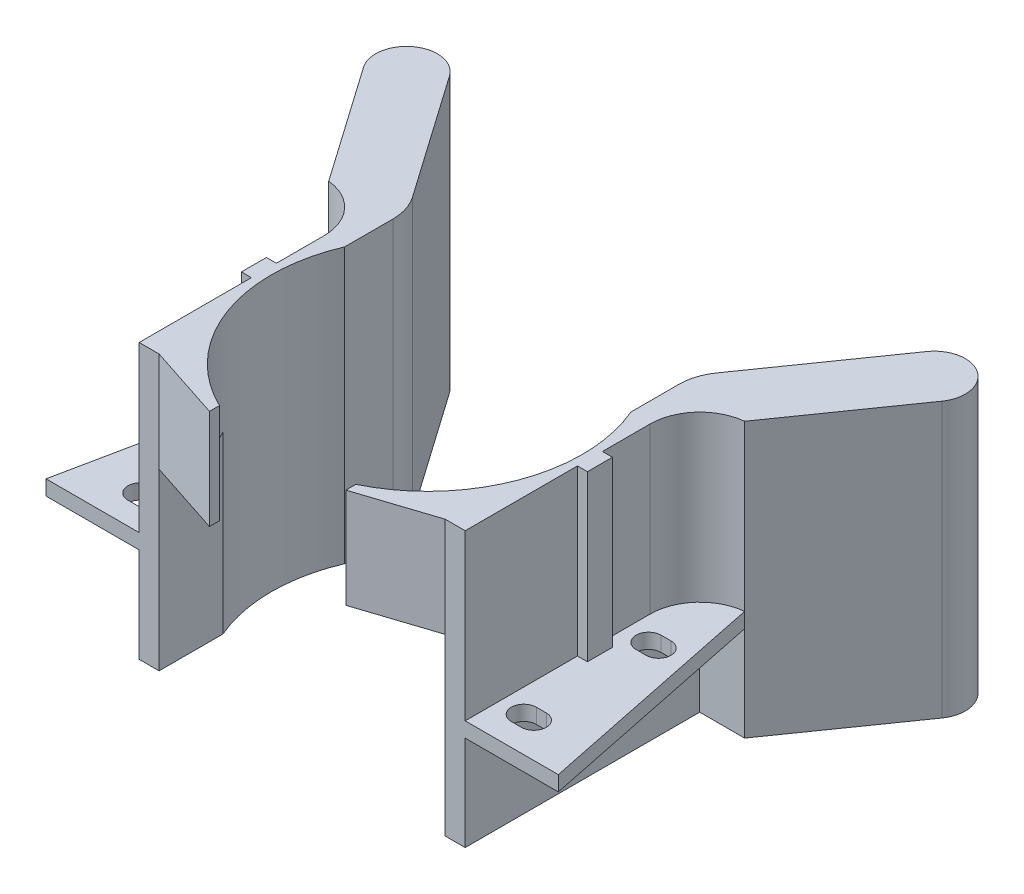
from build123d import *

# Parameters (mm, degrees)
BOSS_EXTRU_1_DEPTH      = 55
CONG_1_R                = 10
ESQUISSE2_R             = 31
ENL_V_MAT_EXTRU_1_DEPTH = 108.780485936
BOSS_EXTRU_2_DEPTH      = 3
ESQUISSE4_W             = 2
ESQUISSE4_H             = 33
BOSS_EXTRU_3_DEPTH      = 2.5
CONG_2_R                = 10
BOSS_EXTRU_4_DEPTH      = 20


with BuildPart() as part:
    # Esquisse1 → Boss.-Extru.1 (new body)
    with BuildSketch(Plane(origin=(0, 20, 0), x_dir=(1, 0, 0), z_dir=(0, 1, 0))):
        with BuildLine():
            Line((32.673562069, -8.580941108), (32.673562069, 38.419058892))
            Line((32.673562069, 38.419058892), (41.673562069, 38.419058892))
            Line((41.673562069, 38.419058892), (57.965753801, 61.686720039))
            ThreePointArc((57.965753801, 61.686720039), (56.44690478, 70.300540881), (47.833083938, 68.781691859))
            Line((47.833083938, 68.781691859), (28.673562069, 41.419058892))
            Line((28.673562069, 41.419058892), (28.673562069, -8.580941108))
            Line((28.673562069, -8.580941108), (32.673562069, -8.580941108))
        make_face()
    extrude(amount=BOSS_EXTRU_1_DEPTH)

    # Congé1
    cong_1_edges = [part.edges().sort_by_distance(p)[0] for p in [
        (28.673562069, 47.5, -41.419058892),
    ]]
    fillet(cong_1_edges, radius=CONG_1_R)

    # Esquisse2 → Enlèv. mat.-Extru.1 (cut, through all)
    with BuildSketch(Plane(origin=(0, 75, 0), x_dir=(1, 0, 0), z_dir=(0, 1, 0))):
        with Locations((0.173562069, 16.419058892)):
            Circle(ESQUISSE2_R)
    extrude(amount=-ENL_V_MAT_EXTRU_1_DEPTH, mode=Mode.SUBTRACT)

    # Esquisse3 → Boss.-Extru.2 (add)
    with BuildSketch(Plane(origin=(0, 39, 0), x_dir=(1, 0, 0), z_dir=(0, 1, 0))):
        Polygon((32.673562069, -8.580941108), (32.673562069, 38.419058892), (41.673562069, 38.419058892), (51.341622453, -8.580941108), align=None)
        with BuildLine():
            Line((37.423562069, 25.919058892), (39.423562069, 25.919058892))
            ThreePointArc((39.423562069, 25.919058892), (41.923562069, 23.419058892), (39.423562069, 20.919058892))
            Line((39.423562069, 20.919058892), (37.423562069, 20.919058892))
            ThreePointArc((37.423562069, 20.919058892), (34.923562069, 23.419058892), (37.423562069, 25.919058892))
        make_face(mode=Mode.SUBTRACT)
        with BuildLine():
            Line((37.423562069, 0.919058892), (39.423562069, 0.919058892))
            ThreePointArc((39.423562069, 0.919058892), (41.923562069, -1.580941108), (39.423562069, -4.080941108))
            Line((39.423562069, -4.080941108), (37.423562069, -4.080941108))
            ThreePointArc((37.423562069, -4.080941108), (34.923562069, -1.580941108), (37.423562069, 0.919058892))
        make_face(mode=Mode.SUBTRACT)
    extrude(amount=BOSS_EXTRU_2_DEPTH)

    # Esquisse4 → Boss.-Extru.3 (add, symmetric)
    with BuildSketch(Plane.XY.offset(-16.419058892)):
        with Locations((33.673562069, 58.5)):
            Rectangle(ESQUISSE4_W, ESQUISSE4_H)
    extrude(amount=BOSS_EXTRU_3_DEPTH, both=True)

    # Congé2
    # the kernel refuses this fillet: 10 mm, written as the material it adds along each edge
    with BuildSketch(Plane(origin=(32.673562069, 17.125314072, -38.419058892), x_dir=(0, 0, 1), z_dir=(0, 1, 0))) as cong_2_piece_1_section:
        with BuildLine():
            CenterArc((9.949874371, 10), CONG_2_R, 185.739170477, 84.260829523)
            Line((0, 9), (0, 0))
            Line((0, 0), (9.949874371, 0))
        make_face()
    cong_2_piece_1 = extrude(amount=57.874685928, mode=Mode.PRIVATE)
    cong_2_piece_1 = split(cong_2_piece_1, bisect_by=Plane(origin=(35.242531185, 39, -35.190804861), z_dir=(0, 1, 0)), keep=Keep.TOP, mode=Mode.PRIVATE)
    add(cong_2_piece_1)

    # Esquisse5 → Boss.-Extru.4 (add)
    with BuildSketch(Plane(origin=(0, 75, 0), x_dir=(1, 0, 0), z_dir=(0, 1, 0))):
        with BuildLine():
            Line((13.673562069, -11.487033633), (13.673562069, -13.487033633))
            Line((13.673562069, -13.487033633), (28.673562069, -8.580941108))
            Line((28.673562069, -8.580941108), (32.673562069, -8.580941108))
            Line((32.673562069, -8.580941108), (32.673562069, 4.222747974))
            Line((32.673562069, 4.222747974), (28.673562069, 4.222747974))
            ThreePointArc((28.673562069, 4.222747974), (22.594518997, -4.988899686), (13.673562069, -11.487033633))
        make_face()
    extrude(amount=-BOSS_EXTRU_4_DEPTH)


with BuildPart() as body_2:
    # Symétrie1: mirrored copy
    add(part.part.mirror(Plane(origin=(0, 0, 0), x_dir=(0, 0, 1), z_dir=(1, 0, 0))))


solid = Compound([part.part, body_2.part])
